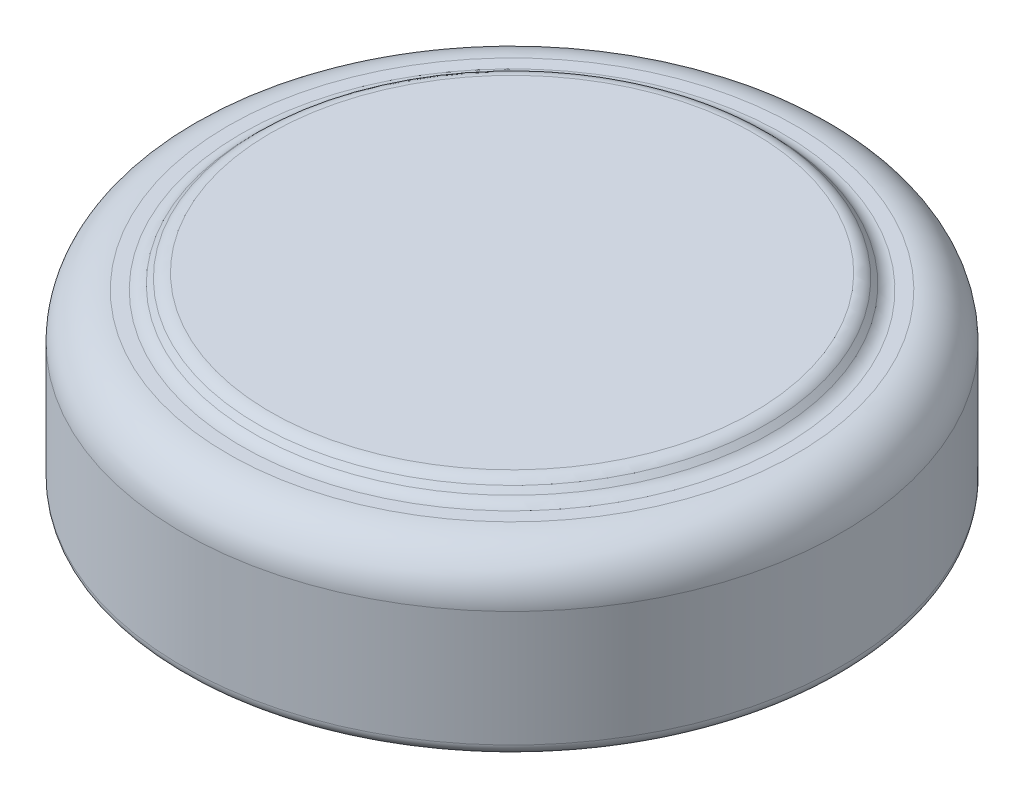
from build123d import *


with BuildPart() as part:
    # Sketch1 → Revolve1 (revolve)
    with BuildSketch(Plane.XY):
        with BuildLine():
            Line((0, 0), (-2.8, 0))
            ThreePointArc((-2.8, 0), (-2.870710678, 0.029289322), (-2.9, 0.1))
            Line((-2.9, 0.1), (-2.9, 1.118))
            ThreePointArc((-2.9, 1.118), (-2.782842712, 1.400842712), (-2.5, 1.518))
            Line((-2.5, 1.518), (-2.382132034, 1.518))
            ThreePointArc((-2.382132034, 1.518), (-2.32472952, 1.52941807), (-2.276066017, 1.561933983))
            Line((-2.276066017, 1.561933983), (-2.231933983, 1.606066017))
            ThreePointArc((-2.231933983, 1.606066017), (-2.18327048, 1.63858193), (-2.125867966, 1.65))
            Line((-2.125867966, 1.65), (0, 1.65))
            Line((0, 1.65), (0, 0))
        make_face()
    revolve(axis=Axis((0, 1.65, 0), (0, -1, 0)))


solid = part.part
